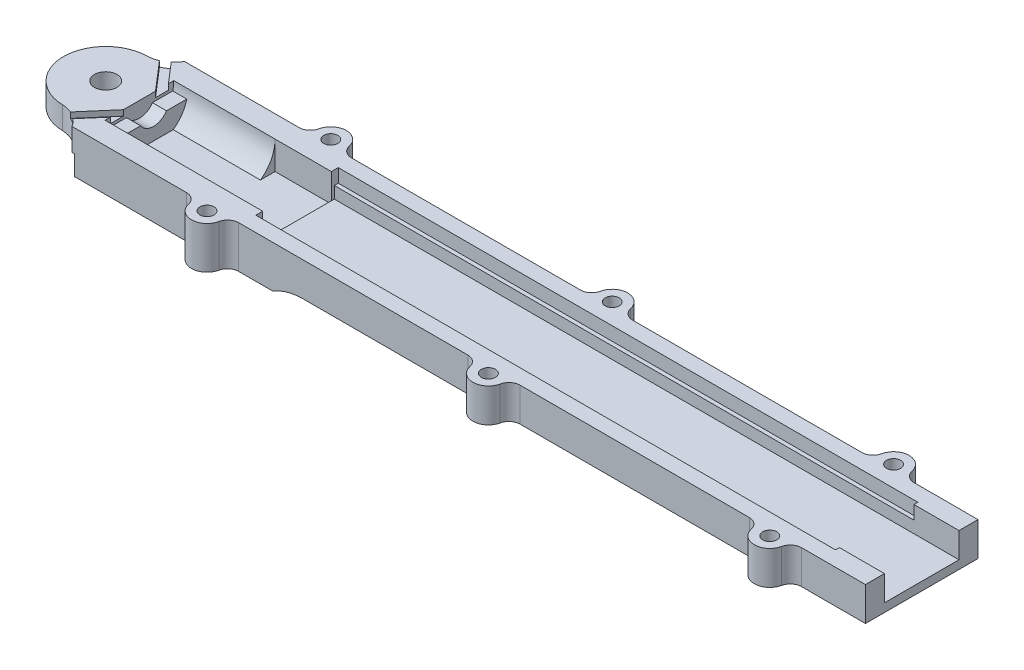
from build123d import *

# Parameters (mm, degrees)
SKETCH1_R                = 2
BOSS_EXTRUDE1_DEPTH      = 4
BOSS_EXTRUDE2_DEPTH      = 6
CUT_EXTRUDE1_START       = -2
CUT_EXTRUDE1_DEPTH       = 18
SKETCH4_W                = 12.2
SKETCH4_H                = 11
CUT_EXTRUDE2_DEPTH       = 10
SKETCH5_W                = 20
SKETCH5_H                = 2
BOSS_EXTRUDE3_DEPTH      = 35
CUT_EXTRUDE7_DEPTH       = 112.736296699
SKETCH14_W               = 20
SKETCH14_H               = 2
CUT_EXTRUDE8_DEPTH       = 142.58036587
FILLET2_R                = 10
FILLET3_R                = 5
CUT_EXTRUDE10_DEPTH      = 142.58036587
CUT_EXTRUDE10_DEPTH_BACK = 142.58036587
SKETCH20_W               = 20
SKETCH20_H               = 4
BOSS_EXTRUDE5_DEPTH      = 2.5
CUT_EXTRUDE11_DEPTH      = 1
SKETCH26_W               = 13.25
SKETCH26_H               = 0.5
BOSS_EXTRUDE6_DEPTH      = 111
SKETCH31_R               = 2.75
SKETCH31_R_2             = 1.25
BOSS_EXTRUDE8_DEPTH      = 8
SKETCH31_5_R             = 2.75
SKETCH31_5_R_2           = 1.25
BOSS_EXTRUDE9_DEPTH      = 6
SKETCH33_R               = 1.25
CUT_EXTRUDE12_DEPTH      = 142.894547112
FILLET4_R                = 2
SKETCH34_W               = 103
SKETCH34_H               = 0.7
CUT_EXTRUDE13_DEPTH      = 2.4
CUT_EXTRUDE14_REACH      = 143.895
SKETCH35_W               = 27.5
SKETCH35_H               = 0.5
CUT_EXTRUDE15_REACH      = 145.183
SKETCH36_W               = 0.5
SKETCH36_H               = 3.5


with BuildPart() as part:
    # Sketch1 → Boss-Extrude1 (new, symmetric)
    with BuildSketch(Plane(origin=(0, 0, 0), x_dir=(1, 0, 0), z_dir=(0, 1, 0))):
        with BuildLine():
            ThreePointArc((-4, 7.5), (-11.5, 0), (-4, -7.5))
            Line((-4, -7.5), (0, -7.5))
            Line((0, -7.5), (0, 7.5))
            Line((0, 7.5), (-4, 7.5))
        make_face()
        with Locations(Location((-4, 0, 0), (0, 0, 270))):
            Circle(SKETCH1_R, mode=Mode.SUBTRACT)
    extrude(amount=BOSS_EXTRUDE1_DEPTH, both=True)

    # Sketch1<3> → Boss-Extrude2 (add, symmetric)
    with BuildSketch(Plane(origin=(0, 0, 0), x_dir=(1, 0, 0), z_dir=(0, 1, 0))):
        Polygon((0, 10), (0, 7.5), (0, 0), (141, 0), (141, 10), align=None)
        Polygon((0, 0), (0, -7.5), (0, -10), (141, -10), (141, 0), align=None)
    extrude(amount=BOSS_EXTRUDE2_DEPTH, both=True)

    # Sketch3 → Cut-Extrude1 (cut)
    with BuildSketch(Plane.ZY.offset(CUT_EXTRUDE1_START)):
        with BuildLine():
            Line((-3.494281042, -5), (3.494281042, -5))
            ThreePointArc((3.494281042, -5), (5.4094877, -2.819120931), (6.1, 0))
            Line((6.1, 0), (6.1, 6))
            Line((6.1, 6), (-6.1, 6))
            Line((-6.1, 6), (-6.1, 0))
            ThreePointArc((-6.1, 0), (-5.4094877, -2.819120931), (-3.494281042, -5))
        make_face()
    extrude(amount=-CUT_EXTRUDE1_DEPTH, mode=Mode.SUBTRACT)

    # Sketch4 → Cut-Extrude2 (cut)
    with BuildSketch(Plane.ZY.offset(-20)):
        with Locations((0, 0.5)):
            Rectangle(SKETCH4_W, SKETCH4_H)
    extrude(amount=-CUT_EXTRUDE2_DEPTH, mode=Mode.SUBTRACT)

    # Sketch5 → Boss-Extrude3 (add)
    with BuildSketch(Plane.ZY):
        with Locations((0, -7)):
            Rectangle(SKETCH5_W, SKETCH5_H)
    extrude(amount=-BOSS_EXTRUDE3_DEPTH)

    # Sketch13 → Cut-Extrude7 (cut, through all)
    with BuildSketch(Plane.ZY.offset(-30)):
        Polygon((-6.625, 5), (-6.625, -1), (-6.625, -5), (6.625, -5), (6.625, -1), (6.625, 5), align=None)
    extrude(amount=-CUT_EXTRUDE7_DEPTH, mode=Mode.SUBTRACT)

    # Sketch14 → Cut-Extrude8 (cut, through all)
    with BuildSketch(Plane.ZY):
        with Locations((0, 5)):
            Rectangle(SKETCH14_W, SKETCH14_H)
    extrude(amount=-CUT_EXTRUDE8_DEPTH, mode=Mode.SUBTRACT)

    # Fillet2
    # the kernel refuses this fillet: 10 mm, written as the material it adds along each edge
    with BuildSketch(Plane(origin=(35, -6, -10), x_dir=(1, 0, 0), z_dir=(0, 0, 1))) as fillet2_piece_1:
        with BuildLine():
            CenterArc((6, -10), FILLET2_R, 90, 36.869897646)
            Line((0, -2), (-0.12, -1.84))
            ThreePointArc((-0.12, -1.84), (-0.2, -1), (-0.2, 0))
            Line((-0.2, 0), (0, 0.2))
            Line((0, 0.2), (6, 0.2))
            Line((6, 0.2), (6, 0))
        make_face()
    extrude(amount=20)

    # Fillet3
    # the kernel refuses this fillet: 5 mm, written as the material it adds along each edge
    with BuildSketch(Plane(origin=(0, -4, 7.5), x_dir=(0, 0, 1), z_dir=(0, 1, 0))) as fillet3_piece_1:
        with BuildLine():
            CenterArc((4.995572165, -4.332680414), FILLET3_R, 119.941428639, 58.533496592)
            Line((-0.002656701, -4.199608248), (-0.502479587, -4.186301032))
            ThreePointArc((-0.502479587, -4.186301032), (-0.5, -4), (-0.5, 0))
            Line((-0.5, 0), (0, 0.5))
            ThreePointArc((0, 0.5), (1.25, 0.5), (2.250442783, 0.433268041))
            Line((2.250442783, 0.433268041), (2.5, 0))
        make_face()
    extrude(amount=8)
    with BuildSketch(Plane(origin=(0, -4, -7.5), x_dir=(0, 0, -1), z_dir=(0, 1, 0))) as fillet3_piece_2:
        with BuildLine():
            CenterArc((4.995572165, 4.332680414), FILLET3_R, 181.525074769, 58.533496592)
            Line((-0.002656701, 4.199608248), (-0.502479587, 4.186301032))
            ThreePointArc((-0.502479587, 4.186301032), (-0.5, 4), (-0.5, 0))
            Line((-0.5, 0), (0, -0.5))
            ThreePointArc((0, -0.5), (1.25, -0.5), (2.250442783, -0.433268041))
            Line((2.250442783, -0.433268041), (2.5, 0))
        make_face()
    extrude(amount=8)

    # Sketch20 → Cut-Extrude10 (cut, two sides: drawn at the far end of the back side and taken through both)
    with BuildSketch(Plane(origin=(0, 0, 0), x_dir=(0, 0, -1), z_dir=(1, 0, 0)).offset(-CUT_EXTRUDE10_DEPTH_BACK)):
        with Locations((0, 2)):
            Rectangle(SKETCH20_W, SKETCH20_H)
    extrude(amount=CUT_EXTRUDE10_DEPTH + CUT_EXTRUDE10_DEPTH_BACK, mode=Mode.SUBTRACT)

    # Sketch16 → Boss-Extrude5 (add)
    with BuildSketch(Plane(origin=(2, 0, 0), x_dir=(0, 0, -1), z_dir=(1, 0, 0))):
        with BuildLine():
            Line((-2.304886114, -1.5), (-5.9126982, -1.5))
            ThreePointArc((-5.9126982, -1.5), (-5.018497246, -3.467662813), (-3.494281042, -5))
            Line((-3.494281042, -5), (3.494281042, -5))
            ThreePointArc((3.494281042, -5), (5.018497246, -3.467662813), (5.9126982, -1.5))
            Line((5.9126982, -1.5), (2.304886114, -1.5))
            ThreePointArc((2.304886114, -1.5), (0, -2.75), (-2.304886114, -1.5))
        make_face()
    extrude(amount=BOSS_EXTRUDE5_DEPTH)

    # Sketch22 → Cut-Extrude11 (cut)
    with BuildSketch(Plane(origin=(0, 0, 0), x_dir=(1, 0, 0), z_dir=(0, 1, 0))):
        Polygon((2, 5.15), (2, 2.85), (-2.349469206, 7.905705794), (-1.064221101, 8.711768032), align=None)
        Polygon((2, -5.15), (2, -2.85), (-2.349469206, -7.905705794), (-1.064221101, -8.711768032), align=None)
    extrude(amount=-CUT_EXTRUDE11_DEPTH, mode=Mode.SUBTRACT)

    # Sketch26 → Boss-Extrude6 (add)
    with BuildSketch(Plane(origin=(141, 0, 0), x_dir=(0, 0, -1), z_dir=(1, 0, 0))):
        with Locations((0, -4.75)):
            Rectangle(SKETCH26_W, SKETCH26_H)
    extrude(amount=-BOSS_EXTRUDE6_DEPTH)

    # Sketch31 → Boss-Extrude8 (add, through all)
    # profile 1 of 2: a face of its own
    with BuildSketch(Plane(origin=(0, 0, 0), x_dir=(1, 0, 0), z_dir=(0, 1, 0))):
        with Locations((25, 11)):
            Circle(SKETCH31_R)
        with Locations((25, 11)):
            Circle(SKETCH31_R_2, mode=Mode.SUBTRACT)
    # profile 2 of 2: a face of its own
    with BuildSketch(Plane(origin=(0, 0, 0), x_dir=(1, 0, 0), z_dir=(0, 1, 0))):
        with Locations((25, -11)):
            Circle(SKETCH31_R)
        with Locations((25, -11)):
            Circle(SKETCH31_R_2, mode=Mode.SUBTRACT)
    extrude(amount=-BOSS_EXTRUDE8_DEPTH)

    # Sketch31<5> → Boss-Extrude9 (add)
    # profile 1 of 6: a face of its own
    with BuildSketch(Plane(origin=(0, 0, 0), x_dir=(1, 0, 0), z_dir=(0, 1, 0))):
        with Locations((25, 11)):
            Circle(SKETCH31_5_R)
        with Locations((25, 11)):
            Circle(SKETCH31_5_R_2, mode=Mode.SUBTRACT)
    # profile 2 of 6: a face of its own
    with BuildSketch(Plane(origin=(0, 0, 0), x_dir=(1, 0, 0), z_dir=(0, 1, 0))):
        with Locations((75, 11)):
            Circle(SKETCH31_5_R)
        with Locations((75, 11)):
            Circle(SKETCH31_5_R_2, mode=Mode.SUBTRACT)
    # profile 3 of 6: a face of its own
    with BuildSketch(Plane(origin=(0, 0, 0), x_dir=(1, 0, 0), z_dir=(0, 1, 0))):
        with Locations((125, 11)):
            Circle(SKETCH31_5_R)
        with Locations((125, 11)):
            Circle(SKETCH31_5_R_2, mode=Mode.SUBTRACT)
    # profile 4 of 6: a face of its own
    with BuildSketch(Plane(origin=(0, 0, 0), x_dir=(1, 0, 0), z_dir=(0, 1, 0))):
        with Locations((125, -11)):
            Circle(SKETCH31_5_R)
        with Locations((125, -11)):
            Circle(SKETCH31_5_R_2, mode=Mode.SUBTRACT)
    # profile 5 of 6: a face of its own
    with BuildSketch(Plane(origin=(0, 0, 0), x_dir=(1, 0, 0), z_dir=(0, 1, 0))):
        with Locations((75, -11)):
            Circle(SKETCH31_5_R)
        with Locations((75, -11)):
            Circle(SKETCH31_5_R_2, mode=Mode.SUBTRACT)
    # profile 6 of 6: a face of its own
    with BuildSketch(Plane(origin=(0, 0, 0), x_dir=(1, 0, 0), z_dir=(0, 1, 0))):
        with Locations((25, -11)):
            Circle(SKETCH31_5_R)
        with Locations((25, -11)):
            Circle(SKETCH31_5_R_2, mode=Mode.SUBTRACT)
    extrude(amount=-BOSS_EXTRUDE9_DEPTH)

    # Sketch33 → Cut-Extrude12 (cut, through all)
    with BuildSketch(Plane(origin=(0, 0, 0), x_dir=(1, 0, 0), z_dir=(0, 1, 0))):
        with Locations(Location((25, 11, 0), (0, 0, 270))):
            Circle(SKETCH33_R)
        with Locations(Location((75, 11, 0), (0, 0, 270))):
            Circle(SKETCH33_R)
        with Locations(Location((75, -11, 0), (0, 0, 270))):
            Circle(SKETCH33_R)
        with Locations(Location((25, -11, 0), (0, 0, 90))):
            Circle(SKETCH33_R)
        with Locations(Location((125, 11, 0), (0, 0, 270))):
            Circle(SKETCH33_R)
        with Locations(Location((125, -11, 0), (0, 0, 270))):
            Circle(SKETCH33_R)
    extrude(amount=-CUT_EXTRUDE12_DEPTH, mode=Mode.SUBTRACT)

    # Fillet4
    fillet4_edges = [part.edges().sort_by_distance(p)[0] for p in [
        (27.561737691, -4, 10),
        (22.438262309, -4, 10),
        (22.438262309, -4, -10),
        (27.561737691, -4, -10),
        (72.438262309, -3, -10),
        (77.561737691, -3, -10),
        (122.438262309, -3, -10),
        (127.561737691, -3, -10),
        (127.561737691, -3, 10),
        (122.438262309, -3, 10),
        (77.561737691, -3, 10),
        (72.438262309, -3, 10),
    ]]
    fillet(fillet4_edges, radius=FILLET4_R)

    # Sketch34 → Cut-Extrude13 (cut)
    with BuildSketch(Plane(origin=(0, 0, 0), x_dir=(1, 0, 0), z_dir=(0, 1, 0))):
        with Locations((81.5, 6.975)):
            Rectangle(SKETCH34_W, SKETCH34_H)
    cut_extrude13 = extrude(amount=-CUT_EXTRUDE13_DEPTH, mode=Mode.SUBTRACT)

    # Mirror1: Cut-Extrude13 across plane
    add(cut_extrude13.mirror(Plane.XY), mode=Mode.SUBTRACT)

    # Sketch35 → Cut-Extrude14 (cut, up to next)
    with BuildSketch(Plane.ZY, mode=Mode.PRIVATE) as cut_extrude14_sk1:
        with Locations((0, -7.75)):
            Rectangle(SKETCH35_W, SKETCH35_H)
    cut_extrude14_tool1 = extrude(cut_extrude14_sk1.sketch, amount=-CUT_EXTRUDE14_REACH, mode=Mode.PRIVATE) & part.part
    add(cut_extrude14_tool1.solids().sort_by_distance((0, -7.75, 0))[0], mode=Mode.SUBTRACT)

    # Sketch36 → Cut-Extrude15 (cut, up to next)
    with BuildSketch(Plane.XY.offset(10), mode=Mode.PRIVATE) as cut_extrude15_sk1:
        with Locations((0.25, -5.75)):
            Rectangle(SKETCH36_W, SKETCH36_H)
    cut_extrude15_tool1 = extrude(cut_extrude15_sk1.sketch, amount=-CUT_EXTRUDE15_REACH, mode=Mode.PRIVATE) & part.part
    add(cut_extrude15_tool1.solids().sort_by_distance((0.25, -5.75, 10))[0], mode=Mode.SUBTRACT)


solid = part.part
